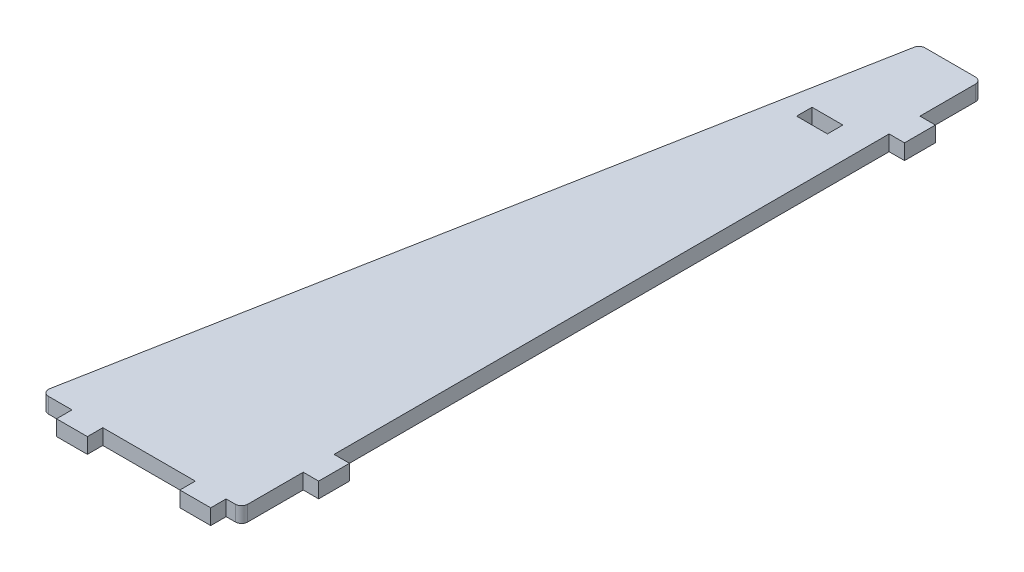
from build123d import *

# Parameters (mm, degrees)
SKETCH1_W           = 12.7
SKETCH1_H           = 6.35
BOSS_EXTRUDE1_DEPTH = 6.35
FILLET1_R           = 2.54


with BuildPart() as part:
    # Sketch1 → Boss-Extrude1 (new body)
    with BuildSketch(Plane(origin=(0, 0, 0), x_dir=(1, 0, 0), z_dir=(0, 1, 0))):
        Polygon((0, 0), (12.7, 0), (12.7, -6.35), (25.4, -6.35), (25.4, 0), (63.5, 0), (63.5, -6.35), (76.2, -6.35), (76.2, 0), (82.55, 0), (82.55, 25.4), (88.9, 25.4), (88.9, 38.1), (82.55, 38.1), (82.55, 266.7), (88.9, 266.7), (88.9, 279.4), (82.55, 279.4), (82.55, 304.8), (57.15, 304.8), align=None)
        with Locations((63.5, 257.175)):
            Rectangle(SKETCH1_W, SKETCH1_H, mode=Mode.SUBTRACT)
    extrude(amount=BOSS_EXTRUDE1_DEPTH)

    # Fillet1
    fillet1_edges = [part.edges().sort_by_distance(p)[0] for p in [
        (82.55, 3.175, 0),
        (82.55, 3.175, -304.8),
        (57.15, 3.175, -304.8),
        (0, 3.175, 0),
    ]]
    fillet(fillet1_edges, radius=FILLET1_R)


solid = part.part
